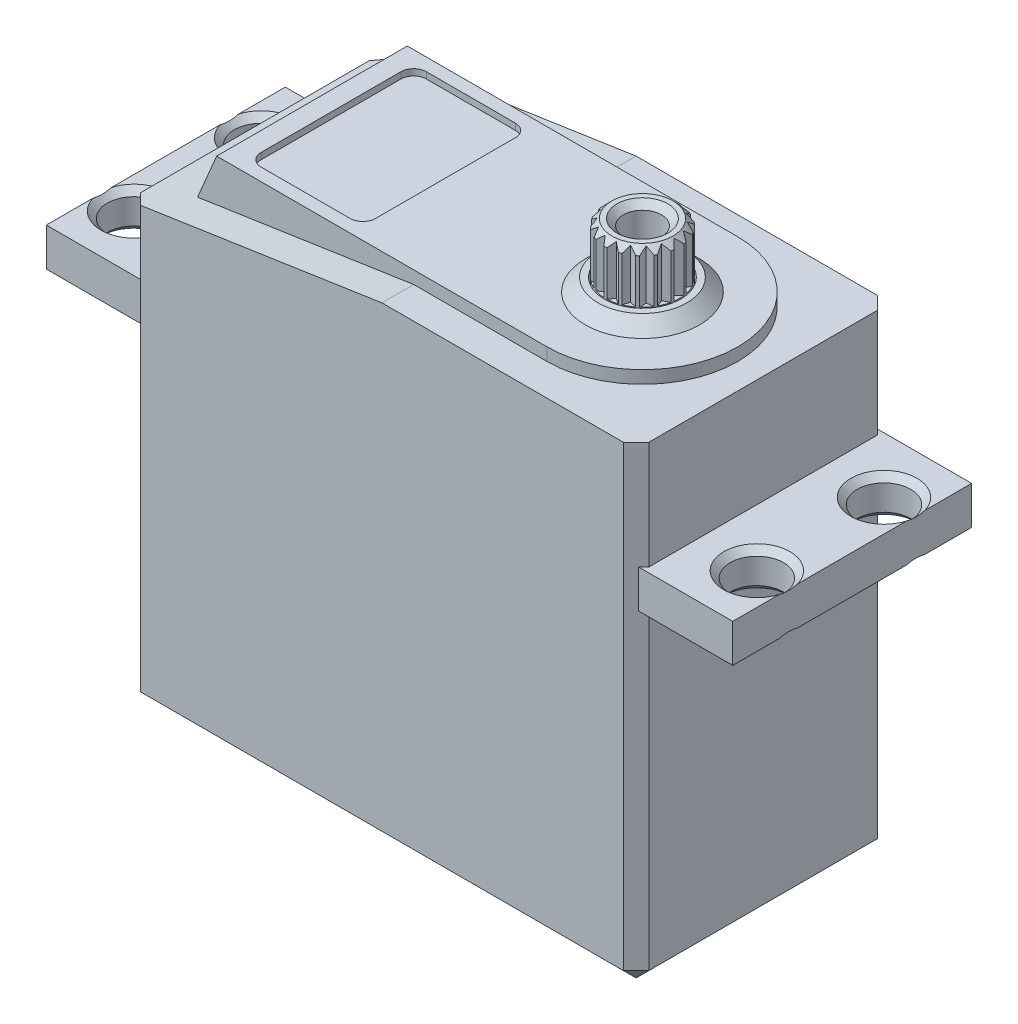
from build123d import *

# Parameters (mm, degrees)
SKETCH_1_W               = 40
SKETCH_1_H               = 20
EXTRUDE_1_DEPTH          = 38
SKETCH_2_R               = 2.9
EXTRUDE_2_DEPTH          = 5
EXTRUDE_START            = -9.5
SKETCH_3_W               = 14
SKETCH_3_H               = 18.8
SKETCH_3_R               = 2.1
EXTRUDE_3_DEPTH          = 3
CHAMFER_1_SIZE           = 0.5
CUT_EXTRUDE_START        = -4
CUT_EXTRUDE_1_DEPTH      = 62.924519851
PATTERN_CIRCULAR_1_COUNT = 18
SKETCH_5_R               = 1.5
CUT_EXTRUDE_2_DEPTH      = 5
SKETCH_6_OUTSIDE_W       = 70.374
SKETCH_6_OUTSIDE_H       = 36.374
CUT_EXTRUDE_4_DEPTH      = 1
CUT_EXTRUDE_5_DEPTH      = 11
CUT_EXTRUDE_6_DEPTH      = 57.182737562
CUT_EXTRUDE_6_DEPTH_BACK = 57.182737562
SKETCH_9_R               = 4.5
SKETCH_9_R_2             = 3
EXTRUDE_4_DEPTH          = 1
CHAMFER_4_SIZE           = 1
CHAMFER_5_SIZE           = 0.5
SKETCH_10_W              = 9
SKETCH_10_H              = 13
CUT_EXTRUDE_7_DEPTH      = 0.5
FILLET_1_R               = 1


# Some blends are built 0.0001 mm under size
with BuildPart() as part:
    # 草图1 → 凸台-拉伸1 (new body)
    with BuildSketch(Plane(origin=(0, 0, 0), x_dir=(1, 0, 0), z_dir=(0, 1, 0))):
        with Locations((-10.5, 0)):
            Rectangle(SKETCH_1_W, SKETCH_1_H)
    extrude(amount=-EXTRUDE_1_DEPTH)

    # 草图2 → 凸台-拉伸2 (add)
    with BuildSketch(Plane(origin=(0, 0, 0), x_dir=(1, 0, 0), z_dir=(0, 1, 0))):
        with Locations(Location((0, 0, 0), (0, 0, 270))):
            Circle(SKETCH_2_R)
    extrude(amount=EXTRUDE_2_DEPTH)

    # 草图3 → 凸台-拉伸3 (add)
    # profile 1 of 2: a face of its own
    with BuildSketch(Plane(origin=(0, 0, 0), x_dir=(1, 0, 0), z_dir=(0, 1, 0)).offset(EXTRUDE_START)):
        with Locations((9.5, 0)):
            Rectangle(SKETCH_3_W, SKETCH_3_H)
        with Locations(Location((14, 5, 0), (0, 0, 270))):
            Circle(SKETCH_3_R, mode=Mode.SUBTRACT)
        with Locations(Location((14, -5, 0), (0, 0, 90))):
            Circle(SKETCH_3_R, mode=Mode.SUBTRACT)
    # profile 2 of 2: a face of its own
    with BuildSketch(Plane(origin=(0, 0, 0), x_dir=(1, 0, 0), z_dir=(0, 1, 0)).offset(EXTRUDE_START)):
        with Locations((-30.5, 0)):
            Rectangle(SKETCH_3_W, SKETCH_3_H)
        with Locations(Location((-35, 5, 0), (0, 0, 90))):
            Circle(SKETCH_3_R, mode=Mode.SUBTRACT)
        with Locations(Location((-35, -5, 0), (0, 0, 270))):
            Circle(SKETCH_3_R, mode=Mode.SUBTRACT)
    extrude(amount=-EXTRUDE_3_DEPTH)

    # 倒角1
    # the kernel refuses this chamfer: 0.5 mm, written as the material it takes off along each edge
    with BuildSketch(Plane(origin=(14, -12.5, 5), x_dir=(0, 0, -1), z_dir=(1, 0, 0))) as chamfer_1_piece_1:
        Polygon((2.1 + CHAMFER_1_SIZE, 0), (2.1, CHAMFER_1_SIZE), (2.1, 0), align=None)
    revolve(axis=Axis((14, -12.5, 5), (0, 1, 0)), mode=Mode.SUBTRACT)
    with BuildSketch(Plane(origin=(14, -12.5, -5), x_dir=(0, 0, 1), z_dir=(-1, 0, 0))) as chamfer_1_piece_2:
        Polygon((2.1 + CHAMFER_1_SIZE, 0), (2.1, CHAMFER_1_SIZE), (2.1, 0), align=None)
    revolve(axis=Axis((14, -12.5, -5), (0, 1, 0)), mode=Mode.SUBTRACT)
    with BuildSketch(Plane(origin=(14, -9.5, -5), x_dir=(0, 0, 1), z_dir=(-1, 0, 0))) as chamfer_1_piece_3:
        Polygon((2.1 + CHAMFER_1_SIZE, 0), (2.1, -CHAMFER_1_SIZE), (2.1, 0), align=None)
    revolve(axis=Axis((14, -9.5, -5), (0, 1, 0)), mode=Mode.SUBTRACT)
    with BuildSketch(Plane(origin=(14, -9.5, 5), x_dir=(0, 0, -1), z_dir=(1, 0, 0))) as chamfer_1_piece_4:
        Polygon((2.1 + CHAMFER_1_SIZE, 0), (2.1, -CHAMFER_1_SIZE), (2.1, 0), align=None)
    revolve(axis=Axis((14, -9.5, 5), (0, 1, 0)), mode=Mode.SUBTRACT)
    with BuildSketch(Plane(origin=(-35, -12.5, 5), x_dir=(0, 0, 1), z_dir=(-1, 0, 0))) as chamfer_1_piece_5:
        Polygon((2.1 + CHAMFER_1_SIZE, 0), (2.1, CHAMFER_1_SIZE), (2.1, 0), align=None)
    revolve(axis=Axis((-35, -12.5, 5), (0, 1, 0)), mode=Mode.SUBTRACT)
    with BuildSketch(Plane(origin=(-35, -12.5, -5), x_dir=(0, 0, -1), z_dir=(1, 0, 0))) as chamfer_1_piece_6:
        Polygon((2.1 + CHAMFER_1_SIZE, 0), (2.1, CHAMFER_1_SIZE), (2.1, 0), align=None)
    revolve(axis=Axis((-35, -12.5, -5), (0, 1, 0)), mode=Mode.SUBTRACT)
    with BuildSketch(Plane(origin=(-35, -9.5, -5), x_dir=(0, 0, -1), z_dir=(1, 0, 0))) as chamfer_1_piece_7:
        Polygon((2.1 + CHAMFER_1_SIZE, 0), (2.1, -CHAMFER_1_SIZE), (2.1, 0), align=None)
    revolve(axis=Axis((-35, -9.5, -5), (0, 1, 0)), mode=Mode.SUBTRACT)
    with BuildSketch(Plane(origin=(-35, -9.5, 5), x_dir=(0, 0, 1), z_dir=(-1, 0, 0))) as chamfer_1_piece_8:
        Polygon((2.1 + CHAMFER_1_SIZE, 0), (2.1, -CHAMFER_1_SIZE), (2.1, 0), align=None)
    revolve(axis=Axis((-35, -9.5, 5), (0, 1, 0)), mode=Mode.SUBTRACT)

    # 倒角2
    # the kernel refuses this chamfer: 1 mm, written as the material it takes off along each edge
    with BuildSketch(Plane(origin=(-29.833333333, -37.333333333, -9.333333333), x_dir=(0.7071067811865475, -0.7071067811865475, 0), z_dir=(-0.5773502691896258, -0.5773502691896258, -0.5773502691896258)), Plane(origin=(8.833333333, -0.666666667, 9.333333333), x_dir=(-0.7071067811865481, 0, 0.7071067811865469), z_dir=(0.5773502691896254, 0.5773502691896254, 0.5773502691896265)), Plane(origin=(8.833333333, -0.666666667, -9.333333333), x_dir=(-0.7071067811865469, 0.7071067811865481, -1.2560739669470211e-15), z_dir=(0.5773502691896267, 0.5773502691896247, -0.5773502691896256))) as chamfer_2_piece_1:
        Polygon((-0.707106781, 0.40824829), (0.707106781, 0.40824829), (0, -0.816496581), align=None)
    extrude(amount=1.270170592, mode=Mode.SUBTRACT)
    with BuildSketch(Plane(origin=(-29.833333333, -37.333333333, 9.333333333), x_dir=(0.7071067811865475, -0.7071067811865475, 0), z_dir=(-0.5773502691896258, -0.5773502691896258, 0.5773502691896258)), Plane(origin=(8.833333333, -37.333333333, 9.333333333), x_dir=(-0.7071067811865481, 0, 0.7071067811865469), z_dir=(0.5773502691896254, -0.5773502691896254, 0.5773502691896265)), Plane(origin=(8.833333333, -37.333333333, -9.333333333), x_dir=(-0.7071067811865469, -0.7071067811865481, -1.2560739669470211e-15), z_dir=(0.5773502691896267, -0.5773502691896247, -0.5773502691896257)), Plane(origin=(-29.833333333, -0.666666667, 9.333333333), x_dir=(0, 0.7071067811865475, -0.7071067811865475), z_dir=(-0.5773502691896257, 0.5773502691896258, 0.5773502691896258)), Plane(origin=(-29.833333333, -0.666666667, -9.333333333), x_dir=(0.7071067811865476, 0.7071067811865475, 0), z_dir=(-0.5773502691896257, 0.5773502691896258, -0.5773502691896258))) as chamfer_2_piece_2:
        Polygon((-0.707106781, -0.40824829), (0.707106781, -0.40824829), (0, 0.816496581), align=None)
    extrude(amount=1.270170592, mode=Mode.SUBTRACT)
    with BuildSketch(Plane(origin=(-30.5, -38, -12.571682988), x_dir=(0.9996219169112968, -0.0274958766105891, 0), z_dir=(0, 0, 1)), Plane(origin=(9.5, 0, 12.571682988), x_dir=(0.02749587661058563, -0.9996219169112968, 0), z_dir=(0, 0, -1))) as chamfer_2_piece_3:
        with BuildLine():
            Line((1.028673195, 0), (-0.056547155, 1.027117794))
            Line((-0.056547155, 1.027117794), (-0.076539593, 1.026567876))
            ThreePointArc((-0.076539593, 1.026567876), (-0.034129227, 0.51339783), (-0.019992438, -0.000549918))
            Line((-0.019992438, -0.000549918), (0.000549918, -0.019992438))
            ThreePointArc((0.000549918, -0.019992438), (0.514497665, -0.00585565), (1.029223113, -0.019992438))
            Line((1.029223113, -0.019992438), (1.028673195, 0))
        make_face()
    extrude(amount=25.143365976, mode=Mode.SUBTRACT)
    with BuildSketch(Plane(origin=(9.5, -38, 12.571682988), x_dir=(0.02749587661058555, 0.9996219169112968, 0), z_dir=(0, 0, -1)), Plane(origin=(-30.5, 0, -12.571682988), x_dir=(0.9996219169112968, 0.02749587661058639, 0), z_dir=(0, 0, 1))) as chamfer_2_piece_4:
        with BuildLine():
            Line((1.028673195, 0), (-0.056547155, -1.027117794))
            Line((-0.056547155, -1.027117794), (-0.076539593, -1.026567876))
            ThreePointArc((-0.076539593, -1.026567876), (-0.034129227, -0.51339783), (-0.019992438, 0.000549918))
            Line((-0.019992438, 0.000549918), (0.000549918, 0.019992438))
            ThreePointArc((0.000549918, 0.019992438), (0.514497665, 0.00585565), (1.029223113, 0.019992438))
            Line((1.029223113, 0.019992438), (1.028673195, 0))
        make_face()
    extrude(amount=25.143365976, mode=Mode.SUBTRACT)
    with BuildSketch(Plane(origin=(9.5, 2.571682988, 10), x_dir=(0.027495876610587375, 0, -0.9996219169112968), z_dir=(0, -1, 0))) as chamfer_2_piece_5_section:
        with BuildLine():
            Line((1.028673195, 0), (-0.056547155, -1.027117794))
            Line((-0.056547155, -1.027117794), (-0.076539593, -1.026567876))
            ThreePointArc((-0.076539593, -1.026567876), (-0.034129227, -0.51339783), (-0.019992438, 0.000549918))
            Line((-0.019992438, 0.000549918), (0.000549918, 0.019992438))
            ThreePointArc((0.000549918, 0.019992438), (0.514497665, 0.00585565), (1.029223113, 0.019992438))
            Line((1.029223113, 0.019992438), (1.028673195, 0))
        make_face()
    chamfer_2_piece_5 = extrude(amount=43.143365976, mode=Mode.PRIVATE)
    chamfer_2_piece_5 = split(chamfer_2_piece_5, bisect_by=Plane(origin=(9.389352312, -3.464158506, 9.4), z_dir=(0, 0, -1)), keep=Keep.TOP, mode=Mode.PRIVATE)
    chamfer_2_piece_5 = split(chamfer_2_piece_5, bisect_by=Plane(origin=(9.389352312, -9.5, 9.251275238), z_dir=(0, 1, 0)), keep=Keep.TOP, mode=Mode.PRIVATE)
    add(chamfer_2_piece_5, mode=Mode.SUBTRACT)
    with BuildSketch(Plane(origin=(9.5, 2.571682988, 10), x_dir=(0.027495876610587375, 0, -0.9996219169112968), z_dir=(0, -1, 0))) as chamfer_2_piece_6_section:
        with BuildLine():
            Line((1.028673195, 0), (-0.056547155, -1.027117794))
            Line((-0.056547155, -1.027117794), (-0.076539593, -1.026567876))
            ThreePointArc((-0.076539593, -1.026567876), (-0.034129227, -0.51339783), (-0.019992438, 0.000549918))
            Line((-0.019992438, 0.000549918), (0.000549918, 0.019992438))
            ThreePointArc((0.000549918, 0.019992438), (0.514497665, 0.00585565), (1.029223113, 0.019992438))
            Line((1.029223113, 0.019992438), (1.028673195, 0))
        make_face()
    chamfer_2_piece_6 = extrude(amount=43.143365976, mode=Mode.PRIVATE)
    chamfer_2_piece_6 = split(chamfer_2_piece_6, bisect_by=Plane(origin=(9.12499054, -3.464158506, 9.4), z_dir=(0, 0, 1)), keep=Keep.TOP, mode=Mode.PRIVATE)
    chamfer_2_piece_6 = split(chamfer_2_piece_6, bisect_by=Plane(origin=(9.12499054, -9.5, 9.756643385), z_dir=(0, 1, 0)), keep=Keep.TOP, mode=Mode.PRIVATE)
    add(chamfer_2_piece_6, mode=Mode.SUBTRACT)
    with BuildSketch(Plane(origin=(9.5, 2.571682988, 10), x_dir=(0.027495876610587375, 0, -0.9996219169112968), z_dir=(0, -1, 0))) as chamfer_2_piece_7_section:
        with BuildLine():
            Line((1.028673195, 0), (-0.056547155, -1.027117794))
            Line((-0.056547155, -1.027117794), (-0.076539593, -1.026567876))
            ThreePointArc((-0.076539593, -1.026567876), (-0.034129227, -0.51339783), (-0.019992438, 0.000549918))
            Line((-0.019992438, 0.000549918), (0.000549918, 0.019992438))
            ThreePointArc((0.000549918, 0.019992438), (0.514497665, 0.00585565), (1.029223113, 0.019992438))
            Line((1.029223113, 0.019992438), (1.028673195, 0))
        make_face()
    chamfer_2_piece_7 = extrude(amount=43.143365976, mode=Mode.PRIVATE)
    chamfer_2_piece_7 = split(chamfer_2_piece_7, bisect_by=Plane(origin=(9.12499054, -11, 9.4), z_dir=(0, 0, 1)), keep=Keep.TOP, mode=Mode.PRIVATE)
    chamfer_2_piece_7 = split(chamfer_2_piece_7, bisect_by=Plane(origin=(9.12499054, -12.5, 9.756643385), z_dir=(0, 1, 0)), keep=Keep.TOP, mode=Mode.PRIVATE)
    chamfer_2_piece_7 = split(chamfer_2_piece_7, bisect_by=Plane(origin=(9.12499054, -9.5, 9.756643385), z_dir=(0, -1, 0)), keep=Keep.TOP, mode=Mode.PRIVATE)
    add(chamfer_2_piece_7, mode=Mode.SUBTRACT)
    with BuildSketch(Plane(origin=(9.5, 2.571682988, 10), x_dir=(0.027495876610587375, 0, -0.9996219169112968), z_dir=(0, -1, 0))) as chamfer_2_piece_8_section:
        with BuildLine():
            Line((1.028673195, 0), (-0.056547155, -1.027117794))
            Line((-0.056547155, -1.027117794), (-0.076539593, -1.026567876))
            ThreePointArc((-0.076539593, -1.026567876), (-0.034129227, -0.51339783), (-0.019992438, 0.000549918))
            Line((-0.019992438, 0.000549918), (0.000549918, 0.019992438))
            ThreePointArc((0.000549918, 0.019992438), (0.514497665, 0.00585565), (1.029223113, 0.019992438))
            Line((1.029223113, 0.019992438), (1.028673195, 0))
        make_face()
    chamfer_2_piece_8 = extrude(amount=43.143365976, mode=Mode.PRIVATE)
    chamfer_2_piece_8 = split(chamfer_2_piece_8, bisect_by=Plane(origin=(9.389352312, -26.535841494, 9.4), z_dir=(0, 0, -1)), keep=Keep.TOP, mode=Mode.PRIVATE)
    chamfer_2_piece_8 = split(chamfer_2_piece_8, bisect_by=Plane(origin=(9.389352312, -12.5, 9.251275238), z_dir=(0, -1, 0)), keep=Keep.TOP, mode=Mode.PRIVATE)
    add(chamfer_2_piece_8, mode=Mode.SUBTRACT)
    with BuildSketch(Plane(origin=(9.5, 2.571682988, 10), x_dir=(0.027495876610587375, 0, -0.9996219169112968), z_dir=(0, -1, 0))) as chamfer_2_piece_9_section:
        with BuildLine():
            Line((1.028673195, 0), (-0.056547155, -1.027117794))
            Line((-0.056547155, -1.027117794), (-0.076539593, -1.026567876))
            ThreePointArc((-0.076539593, -1.026567876), (-0.034129227, -0.51339783), (-0.019992438, 0.000549918))
            Line((-0.019992438, 0.000549918), (0.000549918, 0.019992438))
            ThreePointArc((0.000549918, 0.019992438), (0.514497665, 0.00585565), (1.029223113, 0.019992438))
            Line((1.029223113, 0.019992438), (1.028673195, 0))
        make_face()
    chamfer_2_piece_9 = extrude(amount=43.143365976, mode=Mode.PRIVATE)
    chamfer_2_piece_9 = split(chamfer_2_piece_9, bisect_by=Plane(origin=(9.12499054, -26.535841494, 9.4), z_dir=(0, 0, 1)), keep=Keep.TOP, mode=Mode.PRIVATE)
    chamfer_2_piece_9 = split(chamfer_2_piece_9, bisect_by=Plane(origin=(9.12499054, -12.5, 9.756643385), z_dir=(0, -1, 0)), keep=Keep.TOP, mode=Mode.PRIVATE)
    add(chamfer_2_piece_9, mode=Mode.SUBTRACT)
    with BuildSketch(Plane(origin=(-33.071682988, -38, 10), x_dir=(0, 0.9996219169112968, 0.02749587661058555), z_dir=(1, 0, 0)), Plane(origin=(12.071682988, 0, -10), x_dir=(0, 0.02749587661058639, 0.9996219169112968), z_dir=(-1, 0, 0))) as chamfer_2_piece_10:
        with BuildLine():
            Line((1.028673195, 0), (-0.056547155, -1.027117794))
            Line((-0.056547155, -1.027117794), (-0.076539593, -1.026567876))
            ThreePointArc((-0.076539593, -1.026567876), (-0.034129227, -0.51339783), (-0.019992438, 0.000549918))
            Line((-0.019992438, 0.000549918), (0.000549918, 0.019992438))
            ThreePointArc((0.000549918, 0.019992438), (0.514497665, 0.00585565), (1.029223113, 0.019992438))
            Line((1.029223113, 0.019992438), (1.028673195, 0))
        make_face()
    extrude(amount=45.143365976, mode=Mode.SUBTRACT)
    with BuildSketch(Plane(origin=(-30.5, 2.571682988, 10), x_dir=(0.9996219169112968, 0, 0.027495876610585647), z_dir=(0, -1, 0))) as chamfer_2_piece_11_section:
        with BuildLine():
            Line((1.028673195, 0), (-0.056547155, -1.027117794))
            Line((-0.056547155, -1.027117794), (-0.076539593, -1.026567876))
            ThreePointArc((-0.076539593, -1.026567876), (-0.034129227, -0.51339783), (-0.019992438, 0.000549918))
            Line((-0.019992438, 0.000549918), (0.000549918, 0.019992438))
            ThreePointArc((0.000549918, 0.019992438), (0.514497665, 0.00585565), (1.029223113, 0.019992438))
            Line((1.029223113, 0.019992438), (1.028673195, 0))
        make_face()
    chamfer_2_piece_11 = extrude(amount=43.143365976, mode=Mode.PRIVATE)
    chamfer_2_piece_11 = split(chamfer_2_piece_11, bisect_by=Plane(origin=(-30.12499054, -3.464158506, 9.4), z_dir=(0, 0, 1)), keep=Keep.TOP, mode=Mode.PRIVATE)
    chamfer_2_piece_11 = split(chamfer_2_piece_11, bisect_by=Plane(origin=(-30.12499054, -9.5, 9.756643385), z_dir=(0, 1, 0)), keep=Keep.TOP, mode=Mode.PRIVATE)
    add(chamfer_2_piece_11, mode=Mode.SUBTRACT)
    with BuildSketch(Plane(origin=(-30.5, 2.571682988, 10), x_dir=(0.9996219169112968, 0, 0.027495876610585647), z_dir=(0, -1, 0))) as chamfer_2_piece_12_section:
        with BuildLine():
            Line((1.028673195, 0), (-0.056547155, -1.027117794))
            Line((-0.056547155, -1.027117794), (-0.076539593, -1.026567876))
            ThreePointArc((-0.076539593, -1.026567876), (-0.034129227, -0.51339783), (-0.019992438, 0.000549918))
            Line((-0.019992438, 0.000549918), (0.000549918, 0.019992438))
            ThreePointArc((0.000549918, 0.019992438), (0.514497665, 0.00585565), (1.029223113, 0.019992438))
            Line((1.029223113, 0.019992438), (1.028673195, 0))
        make_face()
    chamfer_2_piece_12 = extrude(amount=43.143365976, mode=Mode.PRIVATE)
    chamfer_2_piece_12 = split(chamfer_2_piece_12, bisect_by=Plane(origin=(-30.389352312, -3.464158506, 9.4), z_dir=(0, 0, -1)), keep=Keep.TOP, mode=Mode.PRIVATE)
    chamfer_2_piece_12 = split(chamfer_2_piece_12, bisect_by=Plane(origin=(-30.389352312, -9.5, 9.251275238), z_dir=(0, 1, 0)), keep=Keep.TOP, mode=Mode.PRIVATE)
    add(chamfer_2_piece_12, mode=Mode.SUBTRACT)
    with BuildSketch(Plane(origin=(-30.5, 2.571682988, 10), x_dir=(0.9996219169112968, 0, 0.027495876610585647), z_dir=(0, -1, 0))) as chamfer_2_piece_13_section:
        with BuildLine():
            Line((1.028673195, 0), (-0.056547155, -1.027117794))
            Line((-0.056547155, -1.027117794), (-0.076539593, -1.026567876))
            ThreePointArc((-0.076539593, -1.026567876), (-0.034129227, -0.51339783), (-0.019992438, 0.000549918))
            Line((-0.019992438, 0.000549918), (0.000549918, 0.019992438))
            ThreePointArc((0.000549918, 0.019992438), (0.514497665, 0.00585565), (1.029223113, 0.019992438))
            Line((1.029223113, 0.019992438), (1.028673195, 0))
        make_face()
    chamfer_2_piece_13 = extrude(amount=43.143365976, mode=Mode.PRIVATE)
    chamfer_2_piece_13 = split(chamfer_2_piece_13, bisect_by=Plane(origin=(-30.12499054, -12.5, 9.756643385), z_dir=(0, 1, 0)), keep=Keep.TOP, mode=Mode.PRIVATE)
    chamfer_2_piece_13 = split(chamfer_2_piece_13, bisect_by=Plane(origin=(-30.12499054, -11, 9.4), z_dir=(0, 0, 1)), keep=Keep.TOP, mode=Mode.PRIVATE)
    chamfer_2_piece_13 = split(chamfer_2_piece_13, bisect_by=Plane(origin=(-30.12499054, -9.5, 9.756643385), z_dir=(0, -1, 0)), keep=Keep.TOP, mode=Mode.PRIVATE)
    add(chamfer_2_piece_13, mode=Mode.SUBTRACT)
    with BuildSketch(Plane(origin=(-30.5, 2.571682988, 10), x_dir=(0.9996219169112968, 0, 0.027495876610585647), z_dir=(0, -1, 0))) as chamfer_2_piece_14_section:
        with BuildLine():
            Line((1.028673195, 0), (-0.056547155, -1.027117794))
            Line((-0.056547155, -1.027117794), (-0.076539593, -1.026567876))
            ThreePointArc((-0.076539593, -1.026567876), (-0.034129227, -0.51339783), (-0.019992438, 0.000549918))
            Line((-0.019992438, 0.000549918), (0.000549918, 0.019992438))
            ThreePointArc((0.000549918, 0.019992438), (0.514497665, 0.00585565), (1.029223113, 0.019992438))
            Line((1.029223113, 0.019992438), (1.028673195, 0))
        make_face()
    chamfer_2_piece_14 = extrude(amount=43.143365976, mode=Mode.PRIVATE)
    chamfer_2_piece_14 = split(chamfer_2_piece_14, bisect_by=Plane(origin=(-30.12499054, -12.5, 9.756643385), z_dir=(0, -1, 0)), keep=Keep.TOP, mode=Mode.PRIVATE)
    chamfer_2_piece_14 = split(chamfer_2_piece_14, bisect_by=Plane(origin=(-30.12499054, -26.535841494, 9.4), z_dir=(0, 0, 1)), keep=Keep.TOP, mode=Mode.PRIVATE)
    add(chamfer_2_piece_14, mode=Mode.SUBTRACT)
    with BuildSketch(Plane(origin=(-30.5, 2.571682988, 10), x_dir=(0.9996219169112968, 0, 0.027495876610585647), z_dir=(0, -1, 0))) as chamfer_2_piece_15_section:
        with BuildLine():
            Line((1.028673195, 0), (-0.056547155, -1.027117794))
            Line((-0.056547155, -1.027117794), (-0.076539593, -1.026567876))
            ThreePointArc((-0.076539593, -1.026567876), (-0.034129227, -0.51339783), (-0.019992438, 0.000549918))
            Line((-0.019992438, 0.000549918), (0.000549918, 0.019992438))
            ThreePointArc((0.000549918, 0.019992438), (0.514497665, 0.00585565), (1.029223113, 0.019992438))
            Line((1.029223113, 0.019992438), (1.028673195, 0))
        make_face()
    chamfer_2_piece_15 = extrude(amount=43.143365976, mode=Mode.PRIVATE)
    chamfer_2_piece_15 = split(chamfer_2_piece_15, bisect_by=Plane(origin=(-30.389352312, -12.5, 9.251275238), z_dir=(0, -1, 0)), keep=Keep.TOP, mode=Mode.PRIVATE)
    chamfer_2_piece_15 = split(chamfer_2_piece_15, bisect_by=Plane(origin=(-30.389352312, -26.535841494, 9.4), z_dir=(0, 0, -1)), keep=Keep.TOP, mode=Mode.PRIVATE)
    add(chamfer_2_piece_15, mode=Mode.SUBTRACT)
    with BuildSketch(Plane(origin=(-33.071682988, 0, 10), x_dir=(0, -0.9996219169112968, 0.02749587661058563), z_dir=(1, 0, 0)), Plane(origin=(12.071682988, -38, -10), x_dir=(0, -0.0274958766105891, 0.9996219169112968), z_dir=(-1, 0, 0))) as chamfer_2_piece_16:
        with BuildLine():
            Line((1.028673195, 0), (-0.056547155, 1.027117794))
            Line((-0.056547155, 1.027117794), (-0.076539593, 1.026567876))
            ThreePointArc((-0.076539593, 1.026567876), (-0.034129227, 0.51339783), (-0.019992438, -0.000549918))
            Line((-0.019992438, -0.000549918), (0.000549918, -0.019992438))
            ThreePointArc((0.000549918, -0.019992438), (0.514497665, -0.00585565), (1.029223113, -0.019992438))
            Line((1.029223113, -0.019992438), (1.028673195, 0))
        make_face()
    extrude(amount=45.143365976, mode=Mode.SUBTRACT)
    with BuildSketch(Plane(origin=(-30.5, 2.571682988, -10), x_dir=(0.9996219169112968, 0, -0.027495876610585647), z_dir=(0, -1, 0))) as chamfer_2_piece_17_section:
        with BuildLine():
            Line((1.028673195, 0), (-0.056547155, 1.027117794))
            Line((-0.056547155, 1.027117794), (-0.076539593, 1.026567876))
            ThreePointArc((-0.076539593, 1.026567876), (-0.034129227, 0.51339783), (-0.019992438, -0.000549918))
            Line((-0.019992438, -0.000549918), (0.000549918, -0.019992438))
            ThreePointArc((0.000549918, -0.019992438), (0.514497665, -0.00585565), (1.029223113, -0.019992438))
            Line((1.029223113, -0.019992438), (1.028673195, 0))
        make_face()
    chamfer_2_piece_17 = extrude(amount=43.143365976, mode=Mode.PRIVATE)
    chamfer_2_piece_17 = split(chamfer_2_piece_17, bisect_by=Plane(origin=(-30.12499054, -9.5, -9.756643385), z_dir=(0, 1, 0)), keep=Keep.TOP, mode=Mode.PRIVATE)
    chamfer_2_piece_17 = split(chamfer_2_piece_17, bisect_by=Plane(origin=(-30.12499054, -3.464158506, -9.4), z_dir=(0, 0, -1)), keep=Keep.TOP, mode=Mode.PRIVATE)
    add(chamfer_2_piece_17, mode=Mode.SUBTRACT)
    with BuildSketch(Plane(origin=(-30.5, 2.571682988, -10), x_dir=(0.9996219169112968, 0, -0.027495876610585647), z_dir=(0, -1, 0))) as chamfer_2_piece_18_section:
        with BuildLine():
            Line((1.028673195, 0), (-0.056547155, 1.027117794))
            Line((-0.056547155, 1.027117794), (-0.076539593, 1.026567876))
            ThreePointArc((-0.076539593, 1.026567876), (-0.034129227, 0.51339783), (-0.019992438, -0.000549918))
            Line((-0.019992438, -0.000549918), (0.000549918, -0.019992438))
            ThreePointArc((0.000549918, -0.019992438), (0.514497665, -0.00585565), (1.029223113, -0.019992438))
            Line((1.029223113, -0.019992438), (1.028673195, 0))
        make_face()
    chamfer_2_piece_18 = extrude(amount=43.143365976, mode=Mode.PRIVATE)
    chamfer_2_piece_18 = split(chamfer_2_piece_18, bisect_by=Plane(origin=(-30.389352312, -9.5, -9.251275238), z_dir=(0, 1, 0)), keep=Keep.TOP, mode=Mode.PRIVATE)
    chamfer_2_piece_18 = split(chamfer_2_piece_18, bisect_by=Plane(origin=(-30.389352312, -3.464158506, -9.4), z_dir=(0, 0, 1)), keep=Keep.TOP, mode=Mode.PRIVATE)
    add(chamfer_2_piece_18, mode=Mode.SUBTRACT)
    with BuildSketch(Plane(origin=(-30.5, 2.571682988, -10), x_dir=(0.9996219169112968, 0, -0.027495876610585647), z_dir=(0, -1, 0))) as chamfer_2_piece_19_section:
        with BuildLine():
            Line((1.028673195, 0), (-0.056547155, 1.027117794))
            Line((-0.056547155, 1.027117794), (-0.076539593, 1.026567876))
            ThreePointArc((-0.076539593, 1.026567876), (-0.034129227, 0.51339783), (-0.019992438, -0.000549918))
            Line((-0.019992438, -0.000549918), (0.000549918, -0.019992438))
            ThreePointArc((0.000549918, -0.019992438), (0.514497665, -0.00585565), (1.029223113, -0.019992438))
            Line((1.029223113, -0.019992438), (1.028673195, 0))
        make_face()
    chamfer_2_piece_19 = extrude(amount=43.143365976, mode=Mode.PRIVATE)
    chamfer_2_piece_19 = split(chamfer_2_piece_19, bisect_by=Plane(origin=(-30.12499054, -12.5, -9.756643385), z_dir=(0, 1, 0)), keep=Keep.TOP, mode=Mode.PRIVATE)
    chamfer_2_piece_19 = split(chamfer_2_piece_19, bisect_by=Plane(origin=(-30.12499054, -9.5, -9.756643385), z_dir=(0, -1, 0)), keep=Keep.TOP, mode=Mode.PRIVATE)
    chamfer_2_piece_19 = split(chamfer_2_piece_19, bisect_by=Plane(origin=(-30.12499054, -11, -9.4), z_dir=(0, 0, -1)), keep=Keep.TOP, mode=Mode.PRIVATE)
    add(chamfer_2_piece_19, mode=Mode.SUBTRACT)
    with BuildSketch(Plane(origin=(-30.5, 2.571682988, -10), x_dir=(0.9996219169112968, 0, -0.027495876610585647), z_dir=(0, -1, 0))) as chamfer_2_piece_20_section:
        with BuildLine():
            Line((1.028673195, 0), (-0.056547155, 1.027117794))
            Line((-0.056547155, 1.027117794), (-0.076539593, 1.026567876))
            ThreePointArc((-0.076539593, 1.026567876), (-0.034129227, 0.51339783), (-0.019992438, -0.000549918))
            Line((-0.019992438, -0.000549918), (0.000549918, -0.019992438))
            ThreePointArc((0.000549918, -0.019992438), (0.514497665, -0.00585565), (1.029223113, -0.019992438))
            Line((1.029223113, -0.019992438), (1.028673195, 0))
        make_face()
    chamfer_2_piece_20 = extrude(amount=43.143365976, mode=Mode.PRIVATE)
    chamfer_2_piece_20 = split(chamfer_2_piece_20, bisect_by=Plane(origin=(-30.12499054, -12.5, -9.756643385), z_dir=(0, -1, 0)), keep=Keep.TOP, mode=Mode.PRIVATE)
    chamfer_2_piece_20 = split(chamfer_2_piece_20, bisect_by=Plane(origin=(-30.12499054, -26.535841494, -9.4), z_dir=(0, 0, -1)), keep=Keep.TOP, mode=Mode.PRIVATE)
    add(chamfer_2_piece_20, mode=Mode.SUBTRACT)
    with BuildSketch(Plane(origin=(-30.5, 2.571682988, -10), x_dir=(0.9996219169112968, 0, -0.027495876610585647), z_dir=(0, -1, 0))) as chamfer_2_piece_21_section:
        with BuildLine():
            Line((1.028673195, 0), (-0.056547155, 1.027117794))
            Line((-0.056547155, 1.027117794), (-0.076539593, 1.026567876))
            ThreePointArc((-0.076539593, 1.026567876), (-0.034129227, 0.51339783), (-0.019992438, -0.000549918))
            Line((-0.019992438, -0.000549918), (0.000549918, -0.019992438))
            ThreePointArc((0.000549918, -0.019992438), (0.514497665, -0.00585565), (1.029223113, -0.019992438))
            Line((1.029223113, -0.019992438), (1.028673195, 0))
        make_face()
    chamfer_2_piece_21 = extrude(amount=43.143365976, mode=Mode.PRIVATE)
    chamfer_2_piece_21 = split(chamfer_2_piece_21, bisect_by=Plane(origin=(-30.389352312, -12.5, -9.251275238), z_dir=(0, -1, 0)), keep=Keep.TOP, mode=Mode.PRIVATE)
    chamfer_2_piece_21 = split(chamfer_2_piece_21, bisect_by=Plane(origin=(-30.389352312, -26.535841494, -9.4), z_dir=(0, 0, 1)), keep=Keep.TOP, mode=Mode.PRIVATE)
    add(chamfer_2_piece_21, mode=Mode.SUBTRACT)
    with BuildSketch(Plane(origin=(9.5, 2.571682988, -10), x_dir=(0.02749587661058392, 0, 0.9996219169112968), z_dir=(0, -1, 0))) as chamfer_2_piece_22_section:
        with BuildLine():
            Line((1.028673195, 0), (-0.056547155, 1.027117794))
            Line((-0.056547155, 1.027117794), (-0.076539593, 1.026567876))
            ThreePointArc((-0.076539593, 1.026567876), (-0.034129227, 0.51339783), (-0.019992438, -0.000549918))
            Line((-0.019992438, -0.000549918), (0.000549918, -0.019992438))
            ThreePointArc((0.000549918, -0.019992438), (0.514497665, -0.00585565), (1.029223113, -0.019992438))
            Line((1.029223113, -0.019992438), (1.028673195, 0))
        make_face()
    chamfer_2_piece_22 = extrude(amount=43.143365976, mode=Mode.PRIVATE)
    chamfer_2_piece_22 = split(chamfer_2_piece_22, bisect_by=Plane(origin=(9.389352312, -3.464158506, -9.4), z_dir=(0, 0, 1)), keep=Keep.TOP, mode=Mode.PRIVATE)
    chamfer_2_piece_22 = split(chamfer_2_piece_22, bisect_by=Plane(origin=(9.389352312, -9.5, -9.251275238), z_dir=(0, 1, 0)), keep=Keep.TOP, mode=Mode.PRIVATE)
    add(chamfer_2_piece_22, mode=Mode.SUBTRACT)
    with BuildSketch(Plane(origin=(9.5, 2.571682988, -10), x_dir=(0.02749587661058392, 0, 0.9996219169112968), z_dir=(0, -1, 0))) as chamfer_2_piece_23_section:
        with BuildLine():
            Line((1.028673195, 0), (-0.056547155, 1.027117794))
            Line((-0.056547155, 1.027117794), (-0.076539593, 1.026567876))
            ThreePointArc((-0.076539593, 1.026567876), (-0.034129227, 0.51339783), (-0.019992438, -0.000549918))
            Line((-0.019992438, -0.000549918), (0.000549918, -0.019992438))
            ThreePointArc((0.000549918, -0.019992438), (0.514497665, -0.00585565), (1.029223113, -0.019992438))
            Line((1.029223113, -0.019992438), (1.028673195, 0))
        make_face()
    chamfer_2_piece_23 = extrude(amount=43.143365976, mode=Mode.PRIVATE)
    chamfer_2_piece_23 = split(chamfer_2_piece_23, bisect_by=Plane(origin=(9.12499054, -3.464158506, -9.4), z_dir=(0, 0, -1)), keep=Keep.TOP, mode=Mode.PRIVATE)
    chamfer_2_piece_23 = split(chamfer_2_piece_23, bisect_by=Plane(origin=(9.12499054, -9.5, -9.756643385), z_dir=(0, 1, 0)), keep=Keep.TOP, mode=Mode.PRIVATE)
    add(chamfer_2_piece_23, mode=Mode.SUBTRACT)
    with BuildSketch(Plane(origin=(9.5, 2.571682988, -10), x_dir=(0.02749587661058392, 0, 0.9996219169112968), z_dir=(0, -1, 0))) as chamfer_2_piece_24_section:
        with BuildLine():
            Line((1.028673195, 0), (-0.056547155, 1.027117794))
            Line((-0.056547155, 1.027117794), (-0.076539593, 1.026567876))
            ThreePointArc((-0.076539593, 1.026567876), (-0.034129227, 0.51339783), (-0.019992438, -0.000549918))
            Line((-0.019992438, -0.000549918), (0.000549918, -0.019992438))
            ThreePointArc((0.000549918, -0.019992438), (0.514497665, -0.00585565), (1.029223113, -0.019992438))
            Line((1.029223113, -0.019992438), (1.028673195, 0))
        make_face()
    chamfer_2_piece_24 = extrude(amount=43.143365976, mode=Mode.PRIVATE)
    chamfer_2_piece_24 = split(chamfer_2_piece_24, bisect_by=Plane(origin=(9.12499054, -12.5, -9.756643385), z_dir=(0, 1, 0)), keep=Keep.TOP, mode=Mode.PRIVATE)
    chamfer_2_piece_24 = split(chamfer_2_piece_24, bisect_by=Plane(origin=(9.12499054, -11, -9.4), z_dir=(0, 0, -1)), keep=Keep.TOP, mode=Mode.PRIVATE)
    chamfer_2_piece_24 = split(chamfer_2_piece_24, bisect_by=Plane(origin=(9.12499054, -9.5, -9.756643385), z_dir=(0, -1, 0)), keep=Keep.TOP, mode=Mode.PRIVATE)
    add(chamfer_2_piece_24, mode=Mode.SUBTRACT)
    with BuildSketch(Plane(origin=(9.5, 2.571682988, -10), x_dir=(0.02749587661058392, 0, 0.9996219169112968), z_dir=(0, -1, 0))) as chamfer_2_piece_25_section:
        with BuildLine():
            Line((1.028673195, 0), (-0.056547155, 1.027117794))
            Line((-0.056547155, 1.027117794), (-0.076539593, 1.026567876))
            ThreePointArc((-0.076539593, 1.026567876), (-0.034129227, 0.51339783), (-0.019992438, -0.000549918))
            Line((-0.019992438, -0.000549918), (0.000549918, -0.019992438))
            ThreePointArc((0.000549918, -0.019992438), (0.514497665, -0.00585565), (1.029223113, -0.019992438))
            Line((1.029223113, -0.019992438), (1.028673195, 0))
        make_face()
    chamfer_2_piece_25 = extrude(amount=43.143365976, mode=Mode.PRIVATE)
    chamfer_2_piece_25 = split(chamfer_2_piece_25, bisect_by=Plane(origin=(9.389352312, -12.5, -9.251275238), z_dir=(0, -1, 0)), keep=Keep.TOP, mode=Mode.PRIVATE)
    chamfer_2_piece_25 = split(chamfer_2_piece_25, bisect_by=Plane(origin=(9.389352312, -26.535841494, -9.4), z_dir=(0, 0, 1)), keep=Keep.TOP, mode=Mode.PRIVATE)
    add(chamfer_2_piece_25, mode=Mode.SUBTRACT)
    with BuildSketch(Plane(origin=(9.5, 2.571682988, -10), x_dir=(0.02749587661058392, 0, 0.9996219169112968), z_dir=(0, -1, 0))) as chamfer_2_piece_26_section:
        with BuildLine():
            Line((1.028673195, 0), (-0.056547155, 1.027117794))
            Line((-0.056547155, 1.027117794), (-0.076539593, 1.026567876))
            ThreePointArc((-0.076539593, 1.026567876), (-0.034129227, 0.51339783), (-0.019992438, -0.000549918))
            Line((-0.019992438, -0.000549918), (0.000549918, -0.019992438))
            ThreePointArc((0.000549918, -0.019992438), (0.514497665, -0.00585565), (1.029223113, -0.019992438))
            Line((1.029223113, -0.019992438), (1.028673195, 0))
        make_face()
    chamfer_2_piece_26 = extrude(amount=43.143365976, mode=Mode.PRIVATE)
    chamfer_2_piece_26 = split(chamfer_2_piece_26, bisect_by=Plane(origin=(9.12499054, -12.5, -9.756643385), z_dir=(0, -1, 0)), keep=Keep.TOP, mode=Mode.PRIVATE)
    chamfer_2_piece_26 = split(chamfer_2_piece_26, bisect_by=Plane(origin=(9.12499054, -26.535841494, -9.4), z_dir=(0, 0, -1)), keep=Keep.TOP, mode=Mode.PRIVATE)
    add(chamfer_2_piece_26, mode=Mode.SUBTRACT)

    # 草图4 → 切除-拉伸1 (cut)
    with BuildSketch(Plane(origin=(0, 5, 0), x_dir=(1, 0, 0), z_dir=(0, 1, 0)).offset(CUT_EXTRUDE_START)):
        with BuildLine():
            ThreePointArc((2.9, 0), (2.892892985, 0.202904349), (2.871606776, 0.404814185))
            Line((2.871606776, 0.404814185), (2.5, 0))
            Line((2.5, 0), (2.871606776, -0.404814185))
            ThreePointArc((2.871606776, -0.404814185), (2.892892985, -0.202904349), (2.9, 0))
        make_face()
    cut_extrude_1 = extrude(amount=CUT_EXTRUDE_1_DEPTH, mode=Mode.SUBTRACT)

    # 阵列(圆周)1: 切除-拉伸1 ×18 about axis
    pattern_circular_1_axis = Axis((-0.017428006, 0, 0), (0, 1, 0))
    for i in range(1, PATTERN_CIRCULAR_1_COUNT):
        add(cut_extrude_1.rotate(pattern_circular_1_axis, i * 360 / PATTERN_CIRCULAR_1_COUNT), mode=Mode.SUBTRACT)

    # 草图5 → 切除-拉伸2 (cut)
    with BuildSketch(Plane(origin=(0, 5, 0), x_dir=(1, 0, 0), z_dir=(0, 1, 0))):
        with Locations(Location((0, 0, 0), (0, 0, 270))):
            Circle(SKETCH_5_R)
    extrude(amount=-CUT_EXTRUDE_2_DEPTH, mode=Mode.SUBTRACT)

    # 草图6 outside → 切除-拉伸4 (cut)
    with BuildSketch(Plane(origin=(0, 0, 0), x_dir=(1, 0, 0), z_dir=(0, 1, 0))):
        with Locations((-10.5, 0)):
            Rectangle(SKETCH_6_OUTSIDE_W, SKETCH_6_OUTSIDE_H)
        with BuildLine():
            Line((0, 7.5), (-27, 7.5))
            Line((-27, 7.5), (-27, -7.5))
            Line((-27, -7.5), (0, -7.5))
            ThreePointArc((0, -7.5), (7.5, 0), (0, 7.5))
        make_face(mode=Mode.SUBTRACT)
    extrude(amount=-CUT_EXTRUDE_4_DEPTH, mode=Mode.SUBTRACT)

    # 草图7 → 切除-拉伸5 (cut)
    with BuildSketch(Plane(origin=(0, 0, -7.5), x_dir=(-1, 0, 0), z_dir=(0, 0, -1))):
        Polygon((10.5, -1), (30.5, -4), (30.5, -1), align=None)
    cut_extrude_5 = extrude(amount=CUT_EXTRUDE_5_DEPTH, mode=Mode.SUBTRACT)

    # 镜向1: 切除-拉伸5 across plane
    add(cut_extrude_5.mirror(Plane.XY), mode=Mode.SUBTRACT)

    # 草图8 → 切除-拉伸6 (cut, two sides: drawn at the far end of the back side and taken through both)
    with BuildSketch(Plane(origin=(0, 0, -7.5), x_dir=(-1, 0, 0), z_dir=(0, 0, -1)).offset(-CUT_EXTRUDE_6_DEPTH_BACK)):
        Polygon((26, 0), (27.5, -3.55), (30.5, -4), (30.5, 0), align=None)
    extrude(amount=CUT_EXTRUDE_6_DEPTH + CUT_EXTRUDE_6_DEPTH_BACK, mode=Mode.SUBTRACT)

    # 草图9 → 凸台-拉伸4 (add)
    with BuildSketch(Plane(origin=(0, 0, 0), x_dir=(1, 0, 0), z_dir=(0, 1, 0))):
        with Locations(Location((0, 0, 0), (0, 0, 270))):
            Circle(SKETCH_9_R)
        with Locations(Location((0, 0, 0), (0, 0, 270))):
            Circle(SKETCH_9_R_2, mode=Mode.SUBTRACT)
    extrude(amount=EXTRUDE_4_DEPTH)

    # 倒角4
    chamfer_4_edges = [part.edges().sort_by_distance(p)[0] for p in [
        (0, 1, -4.5),
    ]]
    chamfer(chamfer_4_edges, length=CHAMFER_4_SIZE - 0.0001)  # a hair under: the kernel refuses the full size

    # 倒角5
    # the kernel refuses this chamfer: 0.5 mm, written as the material it takes off along each edge
    with BuildSketch(Plane(origin=(0, 5, 0), x_dir=(0.9543424742164003, 0, 0.29871464963493055), z_dir=(-0.29871464963493055, 0, 0.9543424742164003))) as chamfer_5_piece_1:
        Polygon((2.9, -CHAMFER_5_SIZE), (2.9 - CHAMFER_5_SIZE, 0), (2.9, 0), align=None)
    revolve(axis=Axis((0, 5, 0), (0, 1, 0)), revolution_arc=54.883847769, mode=Mode.SUBTRACT)
    with BuildSketch(Plane(origin=(0, 5, 0), x_dir=(0.9988875499356074, 0, -0.047155726944236226), z_dir=(0.047155726944236226, 0, 0.9988875499356074))) as chamfer_5_piece_2:
        Polygon((2.9, -CHAMFER_5_SIZE), (2.9 - CHAMFER_5_SIZE, 0), (2.9, 0), align=None)
    revolve(axis=Axis((0, 5, 0), (0, 1, 0)), revolution_arc=54.948709117, mode=Mode.SUBTRACT)
    with BuildSketch(Plane(origin=(0, 5, 0), x_dir=(0.9222926136538984, 0, -0.38649234765964124), z_dir=(0.38649234765964124, 0, 0.9222926136538984))) as chamfer_5_piece_3:
        Polygon((2.9, -CHAMFER_5_SIZE), (2.9 - CHAMFER_5_SIZE, 0), (2.9, 0), align=None)
    revolve(axis=Axis((0, 5, 0), (0, 1, 0)), revolution_arc=55.070555579, mode=Mode.SUBTRACT)
    with BuildSketch(Plane(origin=(0, 5, 0), x_dir=(0.7347207245715968, 0, -0.6783697051645126), z_dir=(0.6783697051645126, 0, 0.7347207245715968))) as chamfer_5_piece_4:
        Polygon((2.9, -CHAMFER_5_SIZE), (2.9 - CHAMFER_5_SIZE, 0), (2.9, 0), align=None)
    revolve(axis=Axis((0, 5, 0), (0, 1, 0)), revolution_arc=55.234606915, mode=Mode.SUBTRACT)
    with BuildSketch(Plane(origin=(0, 5, 0), x_dir=(0.45950116810093694, 0, -0.88817716504866), z_dir=(0.88817716504866, 0, 0.45950116810093694))) as chamfer_5_piece_5:
        Polygon((2.9, -CHAMFER_5_SIZE), (2.9 - CHAMFER_5_SIZE, 0), (2.9, 0), align=None)
    revolve(axis=Axis((0, 5, 0), (0, 1, 0)), revolution_arc=55.420998183, mode=Mode.SUBTRACT)
    with BuildSketch(Plane(origin=(0, 5, 0), x_dir=(0.12999012761607798, 0, -0.9915152881939622), z_dir=(0.9915152881939622, 0, 0.12999012761607798))) as chamfer_5_piece_6:
        Polygon((2.9, -CHAMFER_5_SIZE), (2.9 - CHAMFER_5_SIZE, 0), (2.9, 0), align=None)
    revolve(axis=Axis((0, 5, 0), (0, 1, 0)), revolution_arc=55.607212145, mode=Mode.SUBTRACT)
    with BuildSketch(Plane(origin=(0, 5, 0), x_dir=(-0.21452520255534416, 0, -0.9767184535313074), z_dir=(0.9767184535313074, 0, -0.21452520255534416))) as chamfer_5_piece_7:
        Polygon((2.9, -CHAMFER_5_SIZE), (2.9 - CHAMFER_5_SIZE, 0), (2.9, 0), align=None)
    revolve(axis=Axis((0, 5, 0), (0, 1, 0)), revolution_arc=55.770814465, mode=Mode.SUBTRACT)
    with BuildSketch(Plane(origin=(0, 5, 0), x_dir=(-0.5333535722135326, 0, -0.8458924086472606), z_dir=(0.8458924086472606, 0, -0.5333535722135326))) as chamfer_5_piece_8:
        Polygon((2.9, -CHAMFER_5_SIZE), (2.9 - CHAMFER_5_SIZE, 0), (2.9, 0), align=None)
    revolve(axis=Axis((0, 5, 0), (0, 1, 0)), revolution_arc=55.892150218, mode=Mode.SUBTRACT)
    with BuildSketch(Plane(origin=(0, 5, 0), x_dir=(-0.7889087305139293, 0, -0.6145103863393202), z_dir=(0.6145103863393202, 0, -0.7889087305139293))) as chamfer_5_piece_9:
        Polygon((2.9, -CHAMFER_5_SIZE), (2.9 - CHAMFER_5_SIZE, 0), (2.9, 0), align=None)
    revolve(axis=Axis((0, 5, 0), (0, 1, 0)), revolution_arc=55.956678164, mode=Mode.SUBTRACT)
    with BuildSketch(Plane(origin=(0, 5, 0), x_dir=(-0.950838790848922, 0, -0.30968628290087363), z_dir=(0.30968628290087363, 0, -0.950838790848922))) as chamfer_5_piece_10:
        Polygon((2.9, -CHAMFER_5_SIZE), (2.9 - CHAMFER_5_SIZE, 0), (2.9, 0), align=None)
    revolve(axis=Axis((0, 5, 0), (0, 1, 0)), revolution_arc=55.956678164, mode=Mode.SUBTRACT)
    with BuildSketch(Plane(origin=(0, 5, 0), x_dir=(-0.9994642868910124, 0, 0.03272826346508237), z_dir=(-0.03272826346508237, 0, -0.9994642868910124))) as chamfer_5_piece_11:
        Polygon((2.9, -CHAMFER_5_SIZE), (2.9 - CHAMFER_5_SIZE, 0), (2.9, 0), align=None)
    revolve(axis=Axis((0, 5, 0), (0, 1, 0)), revolution_arc=55.892150218, mode=Mode.SUBTRACT)
    with BuildSketch(Plane(origin=(0, 5, 0), x_dir=(-0.9282165190359255, 0, 0.3720404464420892), z_dir=(-0.3720404464420892, 0, -0.9282165190359255))) as chamfer_5_piece_12:
        Polygon((2.9, -CHAMFER_5_SIZE), (2.9 - CHAMFER_5_SIZE, 0), (2.9, 0), align=None)
    revolve(axis=Axis((0, 5, 0), (0, 1, 0)), revolution_arc=55.770814465, mode=Mode.SUBTRACT)
    with BuildSketch(Plane(origin=(0, 5, 0), x_dir=(-0.7447565224706502, 0, 0.6673362887161345), z_dir=(-0.6673362887161345, 0, -0.7447565224706502))) as chamfer_5_piece_13:
        Polygon((2.9, -CHAMFER_5_SIZE), (2.9 - CHAMFER_5_SIZE, 0), (2.9, 0), align=None)
    revolve(axis=Axis((0, 5, 0), (0, 1, 0)), revolution_arc=55.607212145, mode=Mode.SUBTRACT)
    with BuildSketch(Plane(origin=(0, 5, 0), x_dir=(-0.47048920909109426, 0, 0.8824057480143908), z_dir=(-0.8824057480143908, 0, -0.47048920909109426))) as chamfer_5_piece_14:
        Polygon((2.9, -CHAMFER_5_SIZE), (2.9 - CHAMFER_5_SIZE, 0), (2.9, 0), align=None)
    revolve(axis=Axis((0, 5, 0), (0, 1, 0)), revolution_arc=28.06605684, mode=Mode.SUBTRACT)
    with BuildSketch(Plane(origin=(0, 5, 0), x_dir=(-0.13832588429540835, 0, 0.9903867677497984), z_dir=(-0.9903867677497984, 0, -0.13832588429540835))) as chamfer_5_piece_15:
        Polygon((2.9, -CHAMFER_5_SIZE), (2.9 - CHAMFER_5_SIZE, 0), (2.9, 0), align=None)
    revolve(axis=Axis((0, 5, 0), (0, 1, 0)), revolution_arc=55.234606915, mode=Mode.SUBTRACT)
    with BuildSketch(Plane(origin=(0, 5, 0), x_dir=(0.21120582622440287, 0, 0.9774416089817678), z_dir=(-0.9774416089817678, 0, 0.21120582622440287))) as chamfer_5_piece_16:
        Polygon((2.9, -CHAMFER_5_SIZE), (2.9 - CHAMFER_5_SIZE, 0), (2.9, 0), align=None)
    revolve(axis=Axis((0, 5, 0), (0, 1, 0)), revolution_arc=55.070555579, mode=Mode.SUBTRACT)
    with BuildSketch(Plane(origin=(0, 5, 0), x_dir=(0.5350671344698934, 0, 0.844809541618806), z_dir=(-0.844809541618806, 0, 0.5350671344698934))) as chamfer_5_piece_17:
        Polygon((2.9, -CHAMFER_5_SIZE), (2.9 - CHAMFER_5_SIZE, 0), (2.9, 0), align=None)
    revolve(axis=Axis((0, 5, 0), (0, 1, 0)), revolution_arc=54.948709117, mode=Mode.SUBTRACT)
    with BuildSketch(Plane(origin=(0, 5, 0), x_dir=(0.7933169017222654, 0, 0.608808913733846), z_dir=(-0.608808913733846, 0, 0.7933169017222654))) as chamfer_5_piece_18:
        Polygon((2.9, -CHAMFER_5_SIZE), (2.9 - CHAMFER_5_SIZE, 0), (2.9, 0), align=None)
    revolve(axis=Axis((0, 5, 0), (0, 1, 0)), revolution_arc=54.883847769, mode=Mode.SUBTRACT)
    with BuildSketch(Plane(origin=(0, 5, 0), x_dir=(0, 0, 1), z_dir=(-1, 0, 0))) as chamfer_5_piece_19:
        Polygon((1.5 + CHAMFER_5_SIZE, 0), (1.5, -CHAMFER_5_SIZE), (1.5, 0), align=None)
    revolve(axis=Axis((0, 5, 0), (0, 1, 0)), mode=Mode.SUBTRACT)
    with BuildSketch(Plane(origin=(0, 5, 0), x_dir=(0, 0, 1), z_dir=(-1, 0, 0))) as chamfer_5_piece_20:
        Polygon((2.9, -CHAMFER_5_SIZE), (2.9 - CHAMFER_5_SIZE, 0), (2.9, 0), align=None)
    revolve(axis=Axis((0, 5, 0), (0, 1, 0)), revolution_arc=27.354901478, mode=Mode.SUBTRACT)

    # 草图10 → 切除-拉伸7 (cut)
    with BuildSketch(Plane(origin=(0, 0, 0), x_dir=(1, 0, 0), z_dir=(0, 1, 0))):
        with Locations((-20, 0)):
            Rectangle(SKETCH_10_W, SKETCH_10_H)
    extrude(amount=-CUT_EXTRUDE_7_DEPTH, mode=Mode.SUBTRACT)

    # 圆角1
    fillet_1_edges = [part.edges().sort_by_distance(p)[0] for p in [
        (-15.5, -0.25, -6.5),
        (-15.5, -0.25, 6.5),
        (-24.5, -0.25, 6.5),
        (-24.5, -0.25, -6.5),
    ]]
    fillet(fillet_1_edges, radius=FILLET_1_R)


solid = part.part
